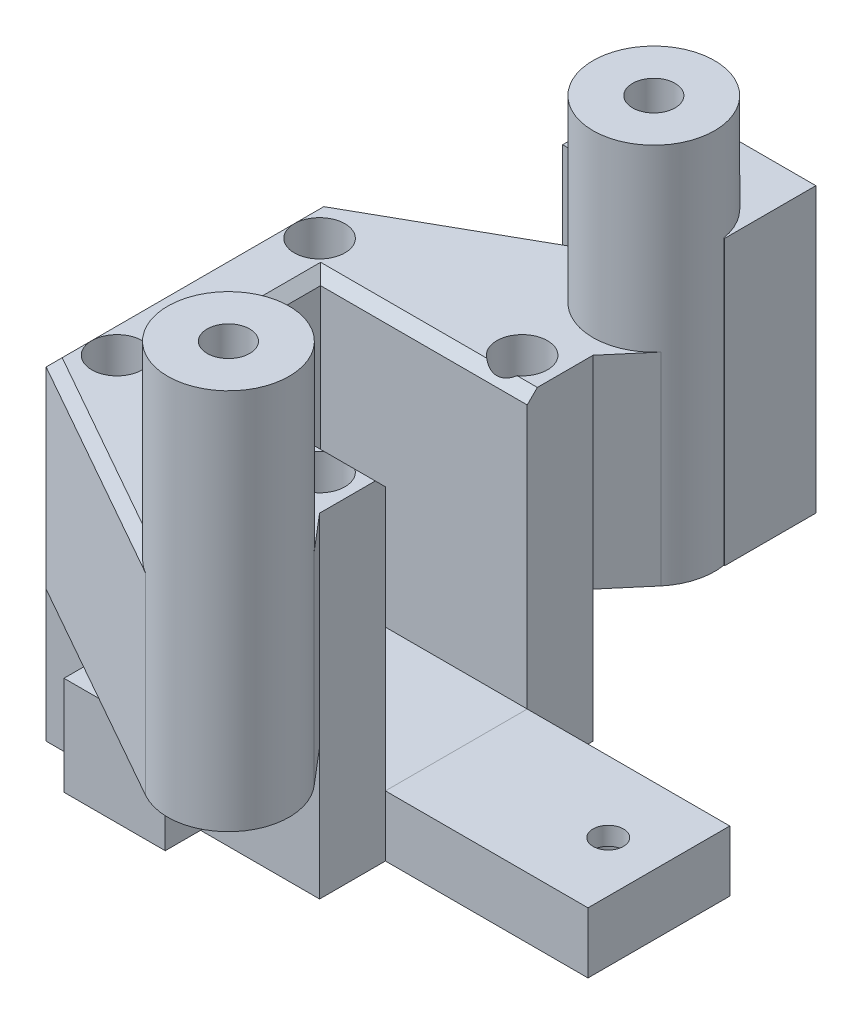
from build123d import *

# Parameters (mm, degrees)
SKETCH1_W                              = 27
SKETCH1_H                              = 27
BOSS_EXTRUDE1_DEPTH                    = 13
SKETCH2_W                              = 20.4
SKETCH2_H                              = 14
CUT_EXTRUDE1_DEPTH                     = 7
F_3_0MM_DOWEL_HOLE1_D                  = 3
F_3_0MM_DOWEL_HOLE1_DEPTH              = 20
F_3_0MM_DOWEL_HOLE1_TIP                = 0.901290929
SKETCH5_W                              = 20
SKETCH5_H                              = 14
BOSS_EXTRUDE2_DEPTH                    = 6
SKETCH10_W                             = 1.5
SKETCH10_H                             = 13
F_3_0MM_DOWEL_HOLE3_AT_2_COUNT         = 2
F_3_0MM_DOWEL_HOLE3_AT_2_PITCH         = 20
F_3_0MM_DOWEL_HOLE3_AT_3_COUNT         = 2
F_3_0MM_DOWEL_HOLE3_AT_3_PITCH         = 28.284271247
F_3_0MM_DOWEL_HOLE3_AT_4_COUNT         = 2
F_3_0MM_DOWEL_HOLE3_AT_4_PITCH         = 20
SKETCH12_R                             = 6
BOSS_EXTRUDE3_DEPTH                    = 37.7
SKETCH13_R                             = 2.5
BOSS_EXTRUDE4_DEPTH                    = 20
LPATTERN1_COUNT                        = 2
LPATTERN1_PITCH                        = 42
CHAMFER1_SIZE                          = 1
BOSS_EXTRUDE5_DEPTH                    = 6.74
SKETCH20_W                             = 2.825
SKETCH20_H                             = 4.2
HOLE1_AT_2_COUNT                       = 2
HOLE1_AT_2_PITCH                       = 25
SKETCH21_W                             = 16
SKETCH21_H                             = 28
BOSS_EXTRUDE7_DEPTH                    = 5
SKETCH17_W                             = 2.1
SKETCH17_H                             = 50.7
M5X0_8_TAPPED_HOLE2_AT_2_COUNT         = 2
M5X0_8_TAPPED_HOLE2_AT_2_PITCH         = 42
BOSS_EXTRUDE8_DEPTH                    = 4
F_3_32_0_140625_DOWEL_HOLE1_AT_2_COUNT = 2
F_3_32_0_140625_DOWEL_HOLE1_AT_2_PITCH = 24.166091947


with BuildPart() as part:
    # Sketch1 → Boss-Extrude1 (new body)
    with BuildSketch(Plane(origin=(0, 0, 0), x_dir=(1, 0, 0), z_dir=(0, 1, 0))):
        Rectangle(SKETCH1_W, SKETCH1_H)
    extrude(amount=BOSS_EXTRUDE1_DEPTH)

    # Sketch2 → Cut-Extrude1 (cut)
    with BuildSketch(Plane(origin=(0, 13, 0), x_dir=(1, 0, 0), z_dir=(0, 1, 0))):
        with Locations((3.3, 0)):
            Rectangle(SKETCH2_W, SKETCH2_H)
    extrude(amount=-CUT_EXTRUDE1_DEPTH, mode=Mode.SUBTRACT)

    # Ø3.0mm Dowel Hole1
    with Locations(Plane(origin=(0, 6, 0), x_dir=(1, 0, 0), z_dir=(0, 1, 0))):
        with Locations((3.5, 0)):
            Hole(F_3_0MM_DOWEL_HOLE1_D / 2, depth=F_3_0MM_DOWEL_HOLE1_DEPTH)
            with Locations((0, 0, -(F_3_0MM_DOWEL_HOLE1_DEPTH + F_3_0MM_DOWEL_HOLE1_TIP / 2))):  # 118° drill point
                Cone(0, F_3_0MM_DOWEL_HOLE1_D / 2, F_3_0MM_DOWEL_HOLE1_TIP, mode=Mode.SUBTRACT)

    # Sketch10 → Ø3.0mm Dowel Hole3 (revolve, cut)
    with BuildSketch(Plane(origin=(-10, 13, -10), x_dir=(0, 0, 1), z_dir=(1, 0, 0))):
        with Locations((0.75, 6.5)):
            Rectangle(SKETCH10_W, SKETCH10_H)
    f_3_0mm_dowel_hole3 = revolve(axis=Axis((-10, 19.35, -10), (0, -1, 0)), mode=Mode.SUBTRACT)

    # Ø3.0mm Dowel Hole3 at 2: Ø3.0mm Dowel Hole3 ×2
    with Locations(*[(0, 0, i * F_3_0MM_DOWEL_HOLE3_AT_2_PITCH) for i in range(1, F_3_0MM_DOWEL_HOLE3_AT_2_COUNT)]):
        add(f_3_0mm_dowel_hole3, mode=Mode.SUBTRACT)

    # Ø3.0mm Dowel Hole3 at 3: Ø3.0mm Dowel Hole3 ×2
    with Locations(*[Vector(0.7071067811865477, 0, 0.7071067811865474) * (i * F_3_0MM_DOWEL_HOLE3_AT_3_PITCH) for i in range(1, F_3_0MM_DOWEL_HOLE3_AT_3_COUNT)]):
        add(f_3_0mm_dowel_hole3, mode=Mode.SUBTRACT)

    # Ø3.0mm Dowel Hole3 at 4: Ø3.0mm Dowel Hole3 ×2
    with Locations(*[(i * F_3_0MM_DOWEL_HOLE3_AT_4_PITCH, 0, 0) for i in range(1, F_3_0MM_DOWEL_HOLE3_AT_4_COUNT)]):
        add(f_3_0mm_dowel_hole3, mode=Mode.SUBTRACT)



with BuildPart() as body_2:
    # Sketch5 → Boss-Extrude2 (new body)
    with BuildSketch(Plane(origin=(0, 0, 0), x_dir=(1, 0, 0), z_dir=(0, 1, 0))):
        with Locations((23.5, 0)):
            Rectangle(SKETCH5_W, SKETCH5_H)
    extrude(amount=BOSS_EXTRUDE2_DEPTH)

    # Sketch7 → Ø3.0mm Dowel Hole2 (revolve, cut)
    with BuildSketch(Plane(origin=(28.5, 6, 0), x_dir=(0, 0, 1), z_dir=(1, 0, 0))):
        Polygon((0, 0), (0, 20.901290929), (1.5, 20), (1.5, 0), align=None)
    revolve(axis=Axis((28.5, 12.35, 0), (0, -1, 0)), mode=Mode.SUBTRACT)


with BuildPart() as body_3:
    # Sketch12 → Boss-Extrude3 (new body)
    with BuildSketch(Plane(origin=(0, 13, 0), x_dir=(1, 0, 0), z_dir=(0, 1, 0))):
        with Locations(Location((12, 21, 0), (0, 0, 270))):
            Circle(SKETCH12_R)
    boss_extrude3 = extrude(amount=BOSS_EXTRUDE3_DEPTH)


with BuildPart() as part_1:
    add(part.part)

    add(body_3.part)  # Boss-Extrude4 merges body 3
    # Sketch13 → Boss-Extrude4 (add)
    with BuildSketch(Plane(origin=(0, 13, 0), x_dir=(1, 0, 0), z_dir=(0, 1, 0))):
        with BuildLine():
            Line((13.5, 7), (13.5, 13.5))
            Line((13.5, 13.5), (16.571858839, 17.114371768))
            ThreePointArc((16.571858839, 17.114371768), (7.372727343, 17.180530435), (9.05133664, 26.225455424))
            Line((9.05133664, 26.225455424), (-13.5, 13.5))
            Line((-13.5, 13.5), (-13.5, 0))
            Line((-13.5, 0), (-6.9, 0))
            Line((-6.9, 0), (-6.9, 7))
            Line((-6.9, 7), (13.5, 7))
        make_face()
        with Locations(Location((-10, 10, 0), (0, 0, 270))):
            Circle(SKETCH13_R, mode=Mode.SUBTRACT)
        with Locations(Location((10, 10, 0), (0, 0, 270))):
            Circle(SKETCH13_R, mode=Mode.SUBTRACT)
    boss_extrude4 = extrude(amount=BOSS_EXTRUDE4_DEPTH)

    # Mirror5: Boss-Extrude4 across plane
    add(boss_extrude4.mirror(Plane.XY))

    # Chamfer1
    # the kernel refuses this chamfer: 1 mm, written as the material it takes off along each edge
    with BuildSketch(Plane(origin=(-6.9, 33, -7), x_dir=(0, 0, -1), z_dir=(1, 0, 0))) as chamfer1_piece_1:
        Polygon((CHAMFER1_SIZE, 0), (0, -CHAMFER1_SIZE), (0, 0), align=None)
    extrude(amount=22.971682988, mode=Mode.SUBTRACT)
    with BuildSketch(Plane(origin=(12.858830839, 33, -28.373979854), x_dir=(0, -1, 0), z_dir=(-0.870909237349507, 0, 0.4914438933380902))) as chamfer1_piece_2_section:
        Polygon((CHAMFER1_SIZE, 0), (0, CHAMFER1_SIZE), (0, 0), align=None)
    chamfer1_piece_2 = extrude(amount=32.83755882, mode=Mode.PRIVATE)
    chamfer1_piece_2 = chamfer1_piece_2 - Plane(origin=(12, 33, -21), x_dir=(0, 0, 1), z_dir=(0, -1, 0)) * Cylinder(6, 70, mode=Mode.PRIVATE)
    add(chamfer1_piece_2, mode=Mode.SUBTRACT)
    with BuildSketch(Plane(origin=(-13.5, 33, 16.071682988), x_dir=(1, 0, 0), z_dir=(0, 0, -1))) as chamfer1_piece_3:
        Polygon((CHAMFER1_SIZE, 0), (0, CHAMFER1_SIZE), (0, 0), align=None)
    extrude(amount=32.143365976, mode=Mode.SUBTRACT)
    with BuildSketch(Plane(origin=(-6.9, 33, 7), x_dir=(-1, 0, 0), z_dir=(0, 0, -1))) as chamfer1_piece_4:
        Polygon((CHAMFER1_SIZE, 0), (0, -CHAMFER1_SIZE), (0, 0), align=None)
    extrude(amount=14, mode=Mode.SUBTRACT)
    with BuildSketch(Plane(origin=(-6.9, 33, 7), x_dir=(0, 0, 1), z_dir=(1, 0, 0))) as chamfer1_piece_5:
        Polygon((CHAMFER1_SIZE, 0), (0, CHAMFER1_SIZE), (0, 0), align=None)
    extrude(amount=22.971682988, mode=Mode.SUBTRACT)
    with BuildSketch(Plane(origin=(12.858830839, 33, 28.373979854), x_dir=(0.49144389333809024, 0, -0.8709092373495071), z_dir=(-0.870909237349507, 0, -0.4914438933380902))) as chamfer1_piece_6:
        Polygon((CHAMFER1_SIZE, 0), (0, CHAMFER1_SIZE), (0, 0), align=None)
    extrude(amount=32.83755882, mode=Mode.SUBTRACT)
    with BuildSketch(Plane(origin=(-6.9, 33, 7), x_dir=(-1, 0, 0), z_dir=(0, 0, -1))) as chamfer1_piece_7a_section:
        Polygon((CHAMFER1_SIZE, 0), (0, -CHAMFER1_SIZE), (0, 0), align=None)
    chamfer1_piece_7a = extrude(amount=16.571682988, mode=Mode.PRIVATE)
    chamfer1_piece_7a = chamfer1_piece_7a - Plane(origin=(-10, 33, -10), x_dir=(0, 0, 1), z_dir=(0, -1, 0)) * Cylinder(2.5, 38, mode=Mode.PRIVATE)
    chamfer1_piece_7a = split(chamfer1_piece_7a, bisect_by=Plane(origin=(-6.9, 33, -7), z_dir=(0, 0, -1)), keep=Keep.TOP, mode=Mode.PRIVATE)
    with BuildSketch(Plane(origin=(-9.471682988, 33, -7), x_dir=(0, 0, -1), z_dir=(1, 0, 0))) as chamfer1_piece_7b_section:
        Polygon((CHAMFER1_SIZE, 0), (0, -CHAMFER1_SIZE), (0, 0), align=None)
    chamfer1_piece_7b = extrude(amount=22.971682988, mode=Mode.PRIVATE)
    chamfer1_piece_7b = chamfer1_piece_7b - Plane(origin=(-10, 33, -10), x_dir=(0, 0, 1), z_dir=(0, -1, 0)) * Cylinder(2.5, 50, mode=Mode.PRIVATE)
    chamfer1_piece_7b = split(chamfer1_piece_7b, bisect_by=Plane(origin=(-6.9, 33, -7), z_dir=(-1, 0, 0)), keep=Keep.TOP, mode=Mode.PRIVATE)
    chamfer1_piece_7 = chamfer1_piece_7a & chamfer1_piece_7b
    add(chamfer1_piece_7, mode=Mode.SUBTRACT)
    with BuildSketch(Plane(origin=(-9.471682988, 33, 7), x_dir=(0, 0, 1), z_dir=(1, 0, 0))) as chamfer1_piece_8a_section:
        Polygon((CHAMFER1_SIZE, 0), (0, CHAMFER1_SIZE), (0, 0), align=None)
    chamfer1_piece_8a = extrude(amount=22.971682988, mode=Mode.PRIVATE)
    chamfer1_piece_8a = chamfer1_piece_8a - Plane(origin=(-10, 33, 10), x_dir=(0, 0, -1), z_dir=(0, -1, 0)) * Cylinder(2.5, 50, mode=Mode.PRIVATE)
    chamfer1_piece_8a = split(chamfer1_piece_8a, bisect_by=Plane(origin=(-6.9, 33, 7), z_dir=(-1, 0, 0)), keep=Keep.TOP, mode=Mode.PRIVATE)
    with BuildSketch(Plane(origin=(-6.9, 33, 9.571682988), x_dir=(-1, 0, 0), z_dir=(0, 0, -1))) as chamfer1_piece_8b_section:
        Polygon((CHAMFER1_SIZE, 0), (0, -CHAMFER1_SIZE), (0, 0), align=None)
    chamfer1_piece_8b = extrude(amount=16.571682988, mode=Mode.PRIVATE)
    chamfer1_piece_8b = chamfer1_piece_8b - Plane(origin=(-10, 33, 10), x_dir=(0, 0, -1), z_dir=(0, -1, 0)) * Cylinder(2.5, 38, mode=Mode.PRIVATE)
    chamfer1_piece_8b = split(chamfer1_piece_8b, bisect_by=Plane(origin=(-6.9, 33, 7), z_dir=(0, 0, 1)), keep=Keep.TOP, mode=Mode.PRIVATE)
    chamfer1_piece_8 = chamfer1_piece_8a & chamfer1_piece_8b
    add(chamfer1_piece_8, mode=Mode.SUBTRACT)

    # Sketch18 → Boss-Extrude5 (add)
    with BuildSketch(Plane.XY.offset(13.5)):
        Polygon((-5, 8.25), (-5, 13), (5, 13), (5, 8.25), (5, 3.25), (-5, 3.25), align=None)
    boss_extrude5 = extrude(amount=BOSS_EXTRUDE5_DEPTH)

    # Mirror7: Boss-Extrude5 across plane
    add(boss_extrude5.mirror(Plane.XY))

    # Sketch20 → Hole1 (revolve, cut)
    with BuildSketch(Plane(origin=(3.5, 0, 0), x_dir=(0, 0, -1), z_dir=(1, 0, 0))):
        with Locations((1.4125, 2.1)):
            Rectangle(SKETCH20_W, SKETCH20_H)
    hole1 = revolve(axis=Axis((3.5, 110, 0), (0, -1, 0)), mode=Mode.SUBTRACT)

    # Sketch21 → Boss-Extrude7 (add)
    with BuildSketch(Plane(origin=(0, 0, -27), x_dir=(-1, 0, 0), z_dir=(0, 0, -1))):
        with Locations((-10, 27)):
            Rectangle(SKETCH21_W, SKETCH21_H)
    extrude(amount=-BOSS_EXTRUDE7_DEPTH)

    # Sketch17 → M5x0.8 Tapped Hole2 (revolve, cut)
    with BuildSketch(Plane(origin=(12, 50.7, -21), x_dir=(0, 0, 1), z_dir=(1, 0, 0))):
        with Locations((1.05, 25.35)):
            Rectangle(SKETCH17_W, SKETCH17_H)
    m5x0_8_tapped_hole2 = revolve(axis=Axis((12, 57.05, -21), (0, -1, 0)), mode=Mode.SUBTRACT)

    # Sketch22 → Boss-Extrude8 (add)
    with BuildSketch(Plane(origin=(0, 0, -27), x_dir=(-1, 0, 0), z_dir=(0, 0, -1))):
        Polygon((-2, 41), (-12, 41), (-18, 41), (-18, 13), (-2, 13), align=None)
    extrude(amount=BOSS_EXTRUDE8_DEPTH)

    # Sketch25 → 3/32 (0.140625) Dowel Hole1 (revolve, cut)
    with BuildSketch(Plane(origin=(15, 16, -31), x_dir=(0, 1, 0), z_dir=(1, 0, 0))):
        Polygon((0, 0), (0, 10.073099512), (1.7859375, 9), (1.7859375, 0), align=None)
    f_3_32_0_140625_dowel_hole1 = revolve(axis=Axis((15, 16, -37.35), (0, 0, 1)), mode=Mode.SUBTRACT)

    # 3/32 (0.140625) Dowel Hole1 at 2: 3/32 (0.140625) Dowel Hole1 ×2
    with Locations(*[Vector(-0.4138029443011841, 0.9103664774626048, 0) * (i * F_3_32_0_140625_DOWEL_HOLE1_AT_2_PITCH) for i in range(1, F_3_32_0_140625_DOWEL_HOLE1_AT_2_COUNT)]):
        add(f_3_32_0_140625_dowel_hole1, mode=Mode.SUBTRACT)


with BuildPart() as lpattern1_1:
    # LPattern1: Boss-Extrude3 ×2
    with Locations(*[(0, 0, i * LPATTERN1_PITCH) for i in range(1, LPATTERN1_COUNT)]):
        add(boss_extrude3)

    # M5x0.8 Tapped Hole2 at 2: M5x0.8 Tapped Hole2 ×2
    with Locations(*[(0, 0, i * M5X0_8_TAPPED_HOLE2_AT_2_PITCH) for i in range(1, M5X0_8_TAPPED_HOLE2_AT_2_COUNT)]):
        add(m5x0_8_tapped_hole2, mode=Mode.SUBTRACT)


with BuildPart() as body_2_1:
    add(body_2.part)

    # Hole1 at 2: Hole1 ×2
    with Locations(*[(i * HOLE1_AT_2_PITCH, 0, 0) for i in range(1, HOLE1_AT_2_COUNT)]):
        add(hole1, mode=Mode.SUBTRACT)


solid = Compound([part_1.part, lpattern1_1.part, body_2_1.part])
